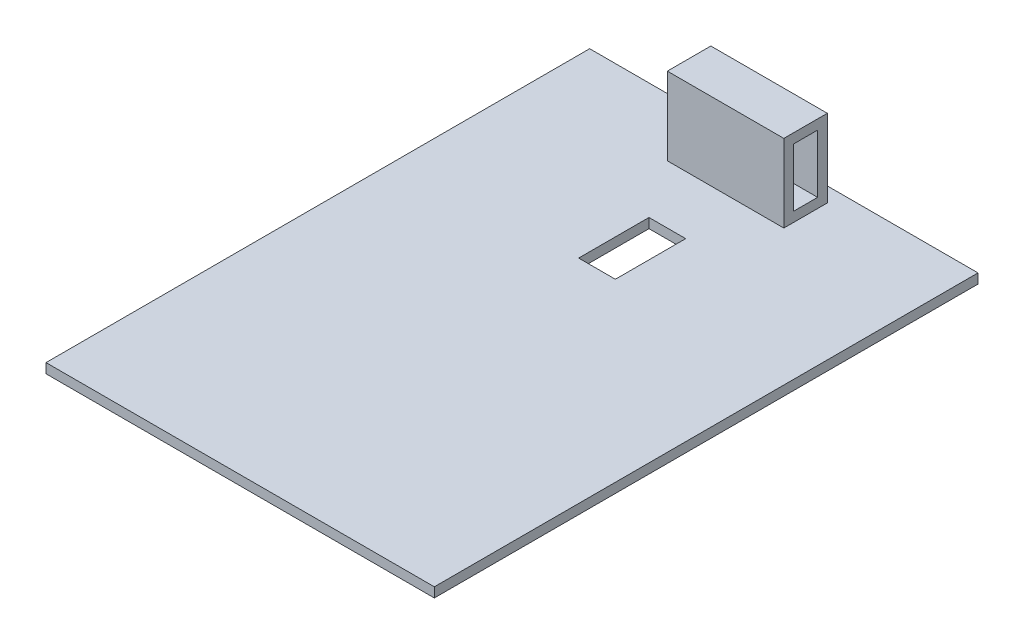
from build123d import *

# Parameters (mm, degrees)
SKETCH1_W           = 127
SKETCH1_H           = 177.8
SKETCH1_W_2         = 12
SKETCH1_H_2         = 23
BOSS_EXTRUDE2_DEPTH = 3.175
SKETCH5_W           = 38.1
SKETCH5_H           = 25.4
BOSS_EXTRUDE3_DEPTH = 14.224
CUT_EXTRUDE1_REACH  = 200.101
SKETCH8_W           = 7.874
SKETCH8_H           = 19.05


with BuildPart() as part:
    # Sketch1 → Boss-Extrude2 (new body)
    with BuildSketch(Plane(origin=(0, 0, 0), x_dir=(1, 0, 0), z_dir=(0, 1, 0))):
        with Locations((63.5, 88.9)):
            Rectangle(SKETCH1_W, SKETCH1_H)
        with Locations((63.5, 128.2)):
            Rectangle(SKETCH1_W_2, SKETCH1_H_2, mode=Mode.SUBTRACT)
    extrude(amount=BOSS_EXTRUDE2_DEPTH)

    # Sketch5 → Boss-Extrude3 (add)
    with BuildSketch(Plane(origin=(0, 0, -158.75), x_dir=(-1, 0, 0), z_dir=(0, 0, -1))):
        with Locations((-63.5, 15.875)):
            Rectangle(SKETCH5_W, SKETCH5_H)
    extrude(amount=BOSS_EXTRUDE3_DEPTH)

    # Sketch8 → Cut-Extrude1 (cut, up to next)
    with BuildSketch(Plane(origin=(82.55, 0, 0), x_dir=(0, 0, -1), z_dir=(1, 0, 0)), mode=Mode.PRIVATE) as cut_extrude1_sk1:
        with Locations((165.862, 15.875)):
            Rectangle(SKETCH8_W, SKETCH8_H)
    cut_extrude1_tool1 = extrude(cut_extrude1_sk1.sketch, amount=-CUT_EXTRUDE1_REACH, mode=Mode.PRIVATE) & part.part
    add(cut_extrude1_tool1.solids().sort_by_distance((82.55, 15.875, -165.862))[0], mode=Mode.SUBTRACT)


solid = part.part
